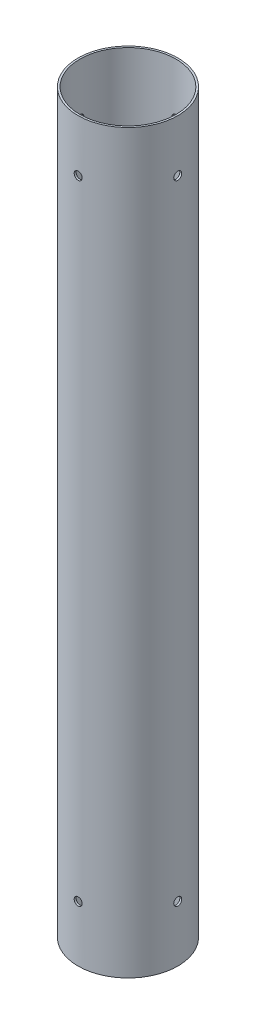
from build123d import *

# Parameters (mm, degrees)
SKETCH4_R           = 39.6
SKETCH4_R_2         = 38.1
BOSS_EXTRUDE2_DEPTH = 584.2
SKETCH5_R           = 3.175
CUT_EXTRUDE1_DEPTH  = 587.878147489
CIRPATTERN1_COUNT   = 4
SKETCH6_R           = 3.175
CUT_EXTRUDE2_DEPTH  = 587.878147602
CIRPATTERN2_COUNT   = 4


with BuildPart() as part:
    # Sketch4 → Boss-Extrude2 (new body)
    with BuildSketch(Plane(origin=(0, 0, 0), x_dir=(1, 0, 0), z_dir=(0, 1, 0))):
        Circle(SKETCH4_R)
        Circle(SKETCH4_R_2, mode=Mode.SUBTRACT)
    extrude(amount=BOSS_EXTRUDE2_DEPTH)

    # Sketch5 → Cut-Extrude1 (cut, through all)
    with BuildSketch(Plane(origin=(0, 0, 0), x_dir=(0, 0, -1), z_dir=(1, 0, 0))):
        with Locations((0, 44.45)):
            Circle(SKETCH5_R)
    cut_extrude1 = extrude(amount=-CUT_EXTRUDE1_DEPTH, mode=Mode.SUBTRACT)

    # CirPattern1: Cut-Extrude1 ×4 about axis
    cirpattern1_axis = Axis((0, 584.2, 0), (0, -1, 0))
    for i in range(1, CIRPATTERN1_COUNT):
        add(cut_extrude1.rotate(cirpattern1_axis, i * 360 / CIRPATTERN1_COUNT), mode=Mode.SUBTRACT)

    # Sketch6 → Cut-Extrude2 (cut, through all)
    with BuildSketch(Plane(origin=(0, 0, 0), x_dir=(0, 0, -1), z_dir=(1, 0, 0))):
        with Locations((0, 542.925)):
            Circle(SKETCH6_R)
    cut_extrude2 = extrude(amount=CUT_EXTRUDE2_DEPTH, mode=Mode.SUBTRACT)

    # CirPattern2: Cut-Extrude2 ×4 about axis
    cirpattern2_axis = Axis((0, 584.2, 0), (0, -1, 0))
    for i in range(1, CIRPATTERN2_COUNT):
        add(cut_extrude2.rotate(cirpattern2_axis, i * 360 / CIRPATTERN2_COUNT), mode=Mode.SUBTRACT)


solid = part.part
